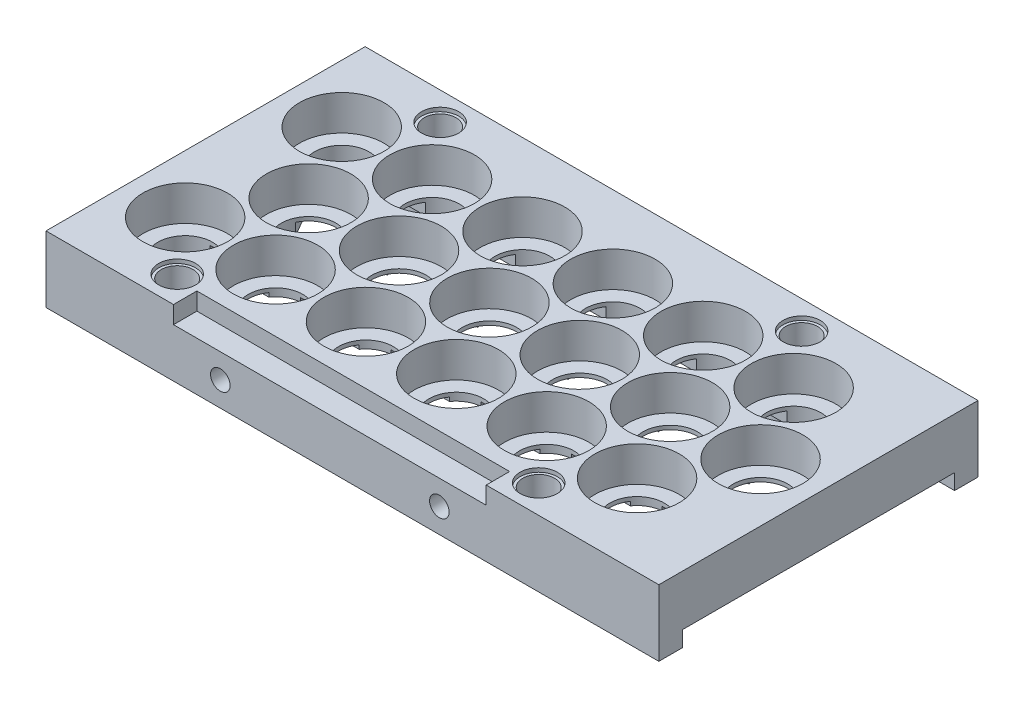
from build123d import *
from build123d.topology import SkipClean

# Parameters (mm, degrees)
SKETCH1_W            = 156.975
SKETCH1_H            = 81.746976195
SKETCH1_R            = 10.825
BOSS_EXTRUDE2_DEPTH  = 11
SKETCH1_3_R          = 10.825
SKETCH1_3_R_2        = 7
BOSS_EXTRUDE3_DEPTH  = 2
CUT_EXTRUDE1_DEPTH   = 1
CUT_EXTRUDE3_REACH   = 157.046
SKETCH9_R            = 4.0767
SKETCH10_R           = 4.7625
CUT_EXTRUDE4_DEPTH   = 1
SKETCH13_R           = 6.5
BOSS_EXTRUDE7_DEPTH  = 6
BOSS_EXTRUDE9_START  = 2
BOSS_EXTRUDE9_DEPTH  = 2
BOSS_EXTRUDE10_DEPTH = 2
SKETCH17_R           = 2.5
CUT_EXTRUDE5_DEPTH   = 4
SKETCH19_W           = 80.1
SKETCH19_H           = 4.475
CUT_EXTRUDE6_DEPTH   = 6
SKETCH20_R           = 2.5
CUT_EXTRUDE7_DEPTH   = 5


with BuildPart() as part:
    # Sketch1 → Boss-Extrude2 (new body)
    with BuildSketch(Plane(origin=(0, 0, 0), x_dir=(1, 0, 0), z_dir=(0, 1, 0))):
        with Locations((63.6625, -20.048488098)):
            Rectangle(SKETCH1_W, SKETCH1_H)
        with Locations((0, -40.096976195)):
            Circle(SKETCH1_R, mode=Mode.SUBTRACT)
        with Locations((23.15, -40.096976195)):
            Circle(SKETCH1_R, mode=Mode.SUBTRACT)
        with Locations((46.3, -40.096976195)):
            Circle(SKETCH1_R, mode=Mode.SUBTRACT)
        with Locations((69.45, -40.096976195)):
            Circle(SKETCH1_R, mode=Mode.SUBTRACT)
        with Locations((92.6, -40.096976195)):
            Circle(SKETCH1_R, mode=Mode.SUBTRACT)
        with Locations((115.75, -40.096976195)):
            Circle(SKETCH1_R, mode=Mode.SUBTRACT)
        with Locations((11.575, -20.048488098)):
            Circle(SKETCH1_R, mode=Mode.SUBTRACT)
        Circle(SKETCH1_R, mode=Mode.SUBTRACT)
        with Locations((23.15, 0)):
            Circle(SKETCH1_R, mode=Mode.SUBTRACT)
        with Locations((34.725, -20.048488098)):
            Circle(SKETCH1_R, mode=Mode.SUBTRACT)
        with Locations((57.875, -20.048488098)):
            Circle(SKETCH1_R, mode=Mode.SUBTRACT)
        with Locations((46.3, 0)):
            Circle(SKETCH1_R, mode=Mode.SUBTRACT)
        with Locations((81.025, -20.048488098)):
            Circle(SKETCH1_R, mode=Mode.SUBTRACT)
        with Locations((69.45, 0)):
            Circle(SKETCH1_R, mode=Mode.SUBTRACT)
        with Locations((92.6, 0)):
            Circle(SKETCH1_R, mode=Mode.SUBTRACT)
        with Locations((104.175, -20.048488098)):
            Circle(SKETCH1_R, mode=Mode.SUBTRACT)
        with Locations((127.325, -20.048488098)):
            Circle(SKETCH1_R, mode=Mode.SUBTRACT)
        with Locations((115.75, 0)):
            Circle(SKETCH1_R, mode=Mode.SUBTRACT)
    extrude(amount=BOSS_EXTRUDE2_DEPTH)

    # Sketch1<3> → Boss-Extrude3 (add)
    # profile 1 of 18: a face of its own
    with BuildSketch(Plane(origin=(0, 0, 0), x_dir=(1, 0, 0), z_dir=(0, 1, 0))):
        Circle(SKETCH1_3_R)
        Circle(SKETCH1_3_R_2, mode=Mode.SUBTRACT)
    # profile 2 of 18: a face of its own
    with BuildSketch(Plane(origin=(0, 0, 0), x_dir=(1, 0, 0), z_dir=(0, 1, 0))):
        with Locations((11.575, -20.048488098)):
            Circle(SKETCH1_3_R)
        with Locations((11.575, -20.048488098)):
            Circle(SKETCH1_3_R_2, mode=Mode.SUBTRACT)
    # profile 3 of 18: a face of its own
    with BuildSketch(Plane(origin=(0, 0, 0), x_dir=(1, 0, 0), z_dir=(0, 1, 0))):
        with Locations((0, -40.096976195)):
            Circle(SKETCH1_3_R)
        with Locations((0, -40.096976195)):
            Circle(SKETCH1_3_R_2, mode=Mode.SUBTRACT)
    # profile 4 of 18: a face of its own
    with BuildSketch(Plane(origin=(0, 0, 0), x_dir=(1, 0, 0), z_dir=(0, 1, 0))):
        with Locations((23.15, 0)):
            Circle(SKETCH1_3_R)
        with Locations((23.15, 0)):
            Circle(SKETCH1_3_R_2, mode=Mode.SUBTRACT)
    # profile 5 of 18: a face of its own
    with BuildSketch(Plane(origin=(0, 0, 0), x_dir=(1, 0, 0), z_dir=(0, 1, 0))):
        with Locations((34.725, -20.048488098)):
            Circle(SKETCH1_3_R)
        with Locations((34.725, -20.048488098)):
            Circle(SKETCH1_3_R_2, mode=Mode.SUBTRACT)
    # profile 6 of 18: a face of its own
    with BuildSketch(Plane(origin=(0, 0, 0), x_dir=(1, 0, 0), z_dir=(0, 1, 0))):
        with Locations((23.15, -40.096976195)):
            Circle(SKETCH1_3_R)
        with Locations((23.15, -40.096976195)):
            Circle(SKETCH1_3_R_2, mode=Mode.SUBTRACT)
    # profile 7 of 18: a face of its own
    with BuildSketch(Plane(origin=(0, 0, 0), x_dir=(1, 0, 0), z_dir=(0, 1, 0))):
        with Locations((46.3, 0)):
            Circle(SKETCH1_3_R)
        with Locations((46.3, 0)):
            Circle(SKETCH1_3_R_2, mode=Mode.SUBTRACT)
    # profile 8 of 18: a face of its own
    with BuildSketch(Plane(origin=(0, 0, 0), x_dir=(1, 0, 0), z_dir=(0, 1, 0))):
        with Locations((57.875, -20.048488098)):
            Circle(SKETCH1_3_R)
        with Locations((57.875, -20.048488098)):
            Circle(SKETCH1_3_R_2, mode=Mode.SUBTRACT)
    # profile 9 of 18: a face of its own
    with BuildSketch(Plane(origin=(0, 0, 0), x_dir=(1, 0, 0), z_dir=(0, 1, 0))):
        with Locations((46.3, -40.096976195)):
            Circle(SKETCH1_3_R)
        with Locations((46.3, -40.096976195)):
            Circle(SKETCH1_3_R_2, mode=Mode.SUBTRACT)
    # profile 10 of 18: a face of its own
    with BuildSketch(Plane(origin=(0, 0, 0), x_dir=(1, 0, 0), z_dir=(0, 1, 0))):
        with Locations((69.45, 0)):
            Circle(SKETCH1_3_R)
        with Locations((69.45, 0)):
            Circle(SKETCH1_3_R_2, mode=Mode.SUBTRACT)
    # profile 11 of 18: a face of its own
    with BuildSketch(Plane(origin=(0, 0, 0), x_dir=(1, 0, 0), z_dir=(0, 1, 0))):
        with Locations((81.025, -20.048488098)):
            Circle(SKETCH1_3_R)
        with Locations((81.025, -20.048488098)):
            Circle(SKETCH1_3_R_2, mode=Mode.SUBTRACT)
    # profile 12 of 18: a face of its own
    with BuildSketch(Plane(origin=(0, 0, 0), x_dir=(1, 0, 0), z_dir=(0, 1, 0))):
        with Locations((69.45, -40.096976195)):
            Circle(SKETCH1_3_R)
        with Locations((69.45, -40.096976195)):
            Circle(SKETCH1_3_R_2, mode=Mode.SUBTRACT)
    # profile 13 of 18: a face of its own
    with BuildSketch(Plane(origin=(0, 0, 0), x_dir=(1, 0, 0), z_dir=(0, 1, 0))):
        with Locations((92.6, 0)):
            Circle(SKETCH1_3_R)
        with Locations((92.6, 0)):
            Circle(SKETCH1_3_R_2, mode=Mode.SUBTRACT)
    # profile 14 of 18: a face of its own
    with BuildSketch(Plane(origin=(0, 0, 0), x_dir=(1, 0, 0), z_dir=(0, 1, 0))):
        with Locations((104.175, -20.048488098)):
            Circle(SKETCH1_3_R)
        with Locations((104.175, -20.048488098)):
            Circle(SKETCH1_3_R_2, mode=Mode.SUBTRACT)
    # profile 15 of 18: a face of its own
    with BuildSketch(Plane(origin=(0, 0, 0), x_dir=(1, 0, 0), z_dir=(0, 1, 0))):
        with Locations((92.6, -40.096976195)):
            Circle(SKETCH1_3_R)
        with Locations((92.6, -40.096976195)):
            Circle(SKETCH1_3_R_2, mode=Mode.SUBTRACT)
    # profile 16 of 18: a face of its own
    with BuildSketch(Plane(origin=(0, 0, 0), x_dir=(1, 0, 0), z_dir=(0, 1, 0))):
        with Locations((115.75, 0)):
            Circle(SKETCH1_3_R)
        with Locations((115.75, 0)):
            Circle(SKETCH1_3_R_2, mode=Mode.SUBTRACT)
    # profile 17 of 18: a face of its own
    with BuildSketch(Plane(origin=(0, 0, 0), x_dir=(1, 0, 0), z_dir=(0, 1, 0))):
        with Locations((127.325, -20.048488098)):
            Circle(SKETCH1_3_R)
        with Locations((127.325, -20.048488098)):
            Circle(SKETCH1_3_R_2, mode=Mode.SUBTRACT)
    # profile 18 of 18: a face of its own
    with BuildSketch(Plane(origin=(0, 0, 0), x_dir=(1, 0, 0), z_dir=(0, 1, 0))):
        with Locations((115.75, -40.096976195)):
            Circle(SKETCH1_3_R)
        with Locations((115.75, -40.096976195)):
            Circle(SKETCH1_3_R_2, mode=Mode.SUBTRACT)
    extrude(amount=BOSS_EXTRUDE3_DEPTH)

    # Sketch2 → Cut-Extrude1 (cut)
    with BuildSketch(Plane.XZ):
        with BuildLine():
            Line((-0.591820292, 33.12203901), (5.238617062, 23.023425283))
            ThreePointArc((5.238617062, 23.023425283), (8.075, 26.110665924), (12.166820292, 27.023425283))
            Line((12.166820292, 27.023425283), (6.92820323, 36.096976195))
            Line((6.92820323, 36.096976195), (17.405437353, 36.096976195))
            ThreePointArc((17.405437353, 36.096976195), (16.15, 40.096976195), (17.405437353, 44.096976195))
            Line((17.405437353, 44.096976195), (5.744562647, 44.096976195))
            ThreePointArc((5.744562647, 44.096976195), (6.062177826, 36.596976195), (-0.591820292, 33.12203901))
        make_face()
        with BuildLine():
            Line((27.79679677, 24.048488098), (17.319562647, 24.048488098))
            ThreePointArc((17.319562647, 24.048488098), (18.575, 20.048488098), (17.319562647, 16.048488098))
            Line((17.319562647, 16.048488098), (27.79679677, 16.048488098))
            Line((27.79679677, 16.048488098), (22.558179708, 6.974937186))
            ThreePointArc((22.558179708, 6.974937186), (26.124937186, 6.336382938), (28.894562647, 4))
            Line((28.894562647, 4), (6.92820323, 4))
            Line((6.92820323, 4), (12.166820292, 13.073550912))
            ThreePointArc((12.166820292, 13.073550912), (8.075, 13.986310271), (5.238617062, 17.073550912))
            Line((5.238617062, 17.073550912), (-0.591820292, 6.974937186))
            ThreePointArc((-0.591820292, 6.974937186), (2.974937186, 6.336382938), (5.744562647, 4))
            Line((5.744562647, 4), (0, 4))
            ThreePointArc((0, 4), (-4, 0), (0, -4))
            Line((0, -4), (115.75, -4))
            ThreePointArc((115.75, -4), (119.75, 0), (115.75, 4))
            Line((115.75, 4), (99.52820323, 4))
            Line((99.52820323, 4), (104.766820292, 13.073550912))
            ThreePointArc((104.766820292, 13.073550912), (97.175, 20.048488098), (104.766820292, 27.023425283))
            Line((104.766820292, 27.023425283), (99.52820323, 36.096976195))
            Line((99.52820323, 36.096976195), (110.005437353, 36.096976195))
            ThreePointArc((110.005437353, 36.096976195), (108.75, 40.096976195), (110.005437353, 44.096976195))
            Line((110.005437353, 44.096976195), (98.344562647, 44.096976195))
            ThreePointArc((98.344562647, 44.096976195), (98.662177826, 36.596976195), (92.008179708, 33.12203901))
            Line((92.008179708, 33.12203901), (97.24679677, 24.048488098))
            Line((97.24679677, 24.048488098), (86.769562647, 24.048488098))
            ThreePointArc((86.769562647, 24.048488098), (88.025, 20.048488098), (86.769562647, 16.048488098))
            Line((86.769562647, 16.048488098), (97.24679677, 16.048488098))
            Line((97.24679677, 16.048488098), (92.008179708, 6.974937186))
            ThreePointArc((92.008179708, 6.974937186), (95.574937186, 6.336382938), (98.344562647, 4))
            Line((98.344562647, 4), (76.37820323, 4))
            Line((76.37820323, 4), (81.616820292, 13.073550912))
            ThreePointArc((81.616820292, 13.073550912), (74.025, 20.048488098), (81.616820292, 27.023425283))
            Line((81.616820292, 27.023425283), (76.37820323, 36.096976195))
            Line((76.37820323, 36.096976195), (86.855437353, 36.096976195))
            ThreePointArc((86.855437353, 36.096976195), (85.6, 40.096976195), (86.855437353, 44.096976195))
            Line((86.855437353, 44.096976195), (75.194562647, 44.096976195))
            ThreePointArc((75.194562647, 44.096976195), (75.512177826, 36.596976195), (68.858179708, 33.12203901))
            Line((68.858179708, 33.12203901), (74.09679677, 24.048488098))
            Line((74.09679677, 24.048488098), (63.619562647, 24.048488098))
            ThreePointArc((63.619562647, 24.048488098), (64.875, 20.048488098), (63.619562647, 16.048488098))
            Line((63.619562647, 16.048488098), (74.09679677, 16.048488098))
            Line((74.09679677, 16.048488098), (68.858179708, 6.974937186))
            ThreePointArc((68.858179708, 6.974937186), (72.424937186, 6.336382938), (75.194562647, 4))
            Line((75.194562647, 4), (53.22820323, 4))
            Line((53.22820323, 4), (58.466820292, 13.073550912))
            ThreePointArc((58.466820292, 13.073550912), (50.875, 20.048488098), (58.466820292, 27.023425283))
            Line((58.466820292, 27.023425283), (53.22820323, 36.096976195))
            Line((53.22820323, 36.096976195), (63.705437353, 36.096976195))
            ThreePointArc((63.705437353, 36.096976195), (62.45, 40.096976195), (63.705437353, 44.096976195))
            Line((63.705437353, 44.096976195), (52.044562647, 44.096976195))
            ThreePointArc((52.044562647, 44.096976195), (52.362177826, 36.596976195), (45.708179708, 33.12203901))
            Line((45.708179708, 33.12203901), (50.94679677, 24.048488098))
            Line((50.94679677, 24.048488098), (40.469562647, 24.048488098))
            ThreePointArc((40.469562647, 24.048488098), (41.725, 20.048488098), (40.469562647, 16.048488098))
            Line((40.469562647, 16.048488098), (50.94679677, 16.048488098))
            Line((50.94679677, 16.048488098), (45.708179708, 6.974937186))
            ThreePointArc((45.708179708, 6.974937186), (49.274937186, 6.336382938), (52.044562647, 4))
            Line((52.044562647, 4), (30.07820323, 4))
            Line((30.07820323, 4), (35.316820292, 13.073550912))
            ThreePointArc((35.316820292, 13.073550912), (27.725, 20.048488098), (35.316820292, 27.023425283))
            Line((35.316820292, 27.023425283), (30.07820323, 36.096976195))
            Line((30.07820323, 36.096976195), (40.555437353, 36.096976195))
            ThreePointArc((40.555437353, 36.096976195), (39.3, 40.096976195), (40.555437353, 44.096976195))
            Line((40.555437353, 44.096976195), (28.894562647, 44.096976195))
            ThreePointArc((28.894562647, 44.096976195), (29.212177826, 36.596976195), (22.558179708, 33.12203901))
            Line((22.558179708, 33.12203901), (27.79679677, 24.048488098))
        make_face()
        with BuildLine():
            Line((127.916820292, 27.023425283), (122.086382938, 37.12203901))
            ThreePointArc((122.086382938, 37.12203901), (119.25, 34.034798369), (115.158179708, 33.12203901))
            Line((115.158179708, 33.12203901), (120.39679677, 24.048488098))
            Line((120.39679677, 24.048488098), (109.919562647, 24.048488098))
            ThreePointArc((109.919562647, 24.048488098), (111.175, 20.048488098), (109.919562647, 16.048488098))
            Line((109.919562647, 16.048488098), (120.39679677, 16.048488098))
            Line((120.39679677, 16.048488098), (115.158179708, 6.974937186))
            ThreePointArc((115.158179708, 6.974937186), (119.25, 6.062177826), (122.086382938, 2.974937186))
            Line((122.086382938, 2.974937186), (127.916820292, 13.073550912))
            ThreePointArc((127.916820292, 13.073550912), (120.325, 20.048488098), (127.916820292, 27.023425283))
        make_face()
    extrude(amount=-CUT_EXTRUDE1_DEPTH, mode=Mode.SUBTRACT)

    # Sketch9 → Cut-Extrude3 (cut, up to next)
    with BuildSketch(Plane(origin=(0, 11, 0), x_dir=(1, 0, 0), z_dir=(0, 1, 0)), mode=Mode.PRIVATE) as cut_extrude3_sk1:
        with Locations((11.575, 13.625)):
            Circle(SKETCH9_R)
    cut_extrude3_tool1 = extrude(cut_extrude3_sk1.sketch, amount=-CUT_EXTRUDE3_REACH, mode=Mode.PRIVATE) & part.part
    # Sketch9 → Cut-Extrude3 (cut, up to next)
    with BuildSketch(Plane(origin=(0, 11, 0), x_dir=(1, 0, 0), z_dir=(0, 1, 0)), mode=Mode.PRIVATE) as cut_extrude3_sk2:
        with Locations((11.575, -53.721976195)):
            Circle(SKETCH9_R)
    cut_extrude3_tool2 = extrude(cut_extrude3_sk2.sketch, amount=-CUT_EXTRUDE3_REACH, mode=Mode.PRIVATE) & part.part
    # Sketch9 → Cut-Extrude3 (cut, up to next)
    with BuildSketch(Plane(origin=(0, 11, 0), x_dir=(1, 0, 0), z_dir=(0, 1, 0)), mode=Mode.PRIVATE) as cut_extrude3_sk3:
        with Locations((104.175, -53.721976195)):
            Circle(SKETCH9_R)
    cut_extrude3_tool3 = extrude(cut_extrude3_sk3.sketch, amount=-CUT_EXTRUDE3_REACH, mode=Mode.PRIVATE) & part.part
    # Sketch9 → Cut-Extrude3 (cut, up to next)
    with BuildSketch(Plane(origin=(0, 11, 0), x_dir=(1, 0, 0), z_dir=(0, 1, 0)), mode=Mode.PRIVATE) as cut_extrude3_sk4:
        with Locations((104.175, 13.625)):
            Circle(SKETCH9_R)
    cut_extrude3_tool4 = extrude(cut_extrude3_sk4.sketch, amount=-CUT_EXTRUDE3_REACH, mode=Mode.PRIVATE) & part.part
    add(cut_extrude3_tool1.solids().sort_by_distance((11.575, 11, -13.625))[0], mode=Mode.SUBTRACT)
    add(cut_extrude3_tool2.solids().sort_by_distance((11.575, 11, 53.721976))[0], mode=Mode.SUBTRACT)
    add(cut_extrude3_tool3.solids().sort_by_distance((104.175, 11, 53.721976))[0], mode=Mode.SUBTRACT)
    add(cut_extrude3_tool4.solids().sort_by_distance((104.175, 11, -13.625))[0], mode=Mode.SUBTRACT)

    # Sketch10 → Cut-Extrude4 (cut)
    with BuildSketch(Plane(origin=(0, 11, 0), x_dir=(1, 0, 0), z_dir=(0, 1, 0))):
        with Locations((11.575, 13.625)):
            Circle(SKETCH10_R)
        with Locations((104.175, 13.625)):
            Circle(SKETCH10_R)
        with Locations((104.175, -53.721976195)):
            Circle(SKETCH10_R)
        with Locations((11.575, -53.721976195)):
            Circle(SKETCH10_R)
    extrude(amount=-CUT_EXTRUDE4_DEPTH, mode=Mode.SUBTRACT)

    # Sketch13 → Boss-Extrude7 (add)
    # profile 1 of 2: a face of its own
    with BuildSketch(Plane.XZ):
        with BuildLine():
            ThreePointArc((3.665512027, 54.921976195), (11.575, 45.721976195), (19.484487973, 54.921976195))
            Line((19.484487973, 54.921976195), (96.265512027, 54.921976195))
            ThreePointArc((96.265512027, 54.921976195), (104.175, 45.721976195), (112.084487973, 54.921976195))
            Line((112.084487973, 54.921976195), (142.15, 54.921976195))
            Line((142.15, 54.921976195), (142.15, 60.921976195))
            Line((142.15, 60.921976195), (-14.825, 60.921976195))
            Line((-14.825, 60.921976195), (-14.825, 54.921976195))
            Line((-14.825, 54.921976195), (3.665512027, 54.921976195))
        make_face()
        with Locations((11.575, 53.721976195)):
            Circle(SKETCH13_R, mode=Mode.SUBTRACT)
        with Locations((104.175, 53.721976195)):
            Circle(SKETCH13_R, mode=Mode.SUBTRACT)
    # profile 2 of 2: a face of its own
    with BuildSketch(Plane.XZ):
        with BuildLine():
            Line((-14.825, -14.825), (-14.825, -20.825))
            Line((-14.825, -20.825), (142.15, -20.825))
            Line((142.15, -20.825), (142.15, -14.825))
            Line((142.15, -14.825), (112.084487973, -14.825))
            ThreePointArc((112.084487973, -14.825), (104.175, -5.625), (96.265512027, -14.825))
            Line((96.265512027, -14.825), (19.484487973, -14.825))
            ThreePointArc((19.484487973, -14.825), (11.575, -5.625), (3.665512027, -14.825))
            Line((3.665512027, -14.825), (-14.825, -14.825))
        make_face()
        with Locations((11.575, -13.625)):
            Circle(SKETCH13_R, mode=Mode.SUBTRACT)
        with Locations((104.175, -13.625)):
            Circle(SKETCH13_R, mode=Mode.SUBTRACT)
    extrude(amount=BOSS_EXTRUDE7_DEPTH)

    # Sketch14 → Boss-Extrude9 (add)
    with SkipClean():  # the faces are left unmerged after this step: merging them gives an invalid solid
        with BuildSketch(Plane.XZ.offset(BOSS_EXTRUDE9_START)):
            with BuildLine():
                Line((142.15, 54.921976195), (142.15, -14.825))
                Line((142.15, -14.825), (112.084487973, -14.825))
                ThreePointArc((112.084487973, -14.825), (104.175, -5.625), (96.265512027, -14.825))
                Line((96.265512027, -14.825), (19.484487973, -14.825))
                ThreePointArc((19.484487973, -14.825), (11.575, -5.625), (3.665512027, -14.825))
                Line((3.665512027, -14.825), (-14.825, -14.825))
                Line((-14.825, -14.825), (-14.825, 54.921976195))
                Line((-14.825, 54.921976195), (3.665512027, 54.921976195))
                ThreePointArc((3.665512027, 54.921976195), (11.575, 45.721976195), (19.484487973, 54.921976195))
                Line((19.484487973, 54.921976195), (96.265512027, 54.921976195))
                ThreePointArc((96.265512027, 54.921976195), (104.175, 45.721976195), (112.084487973, 54.921976195))
                Line((112.084487973, 54.921976195), (142.15, 54.921976195))
            make_face()
            with BuildLine():
                Line((5.238617062, 17.073550912), (-0.591820292, 6.974937186))
                ThreePointArc((-0.591820292, 6.974937186), (-6.062177826, -3.5), (5.744562647, -4))
                Line((5.744562647, -4), (17.405437353, -4))
                ThreePointArc((17.405437353, -4), (23.15, -7), (28.894562647, -4))
                Line((28.894562647, -4), (40.555437353, -4))
                ThreePointArc((40.555437353, -4), (46.3, -7), (52.044562647, -4))
                Line((52.044562647, -4), (63.705437353, -4))
                ThreePointArc((63.705437353, -4), (69.45, -7), (75.194562647, -4))
                Line((75.194562647, -4), (86.855437353, -4))
                ThreePointArc((86.855437353, -4), (92.6, -7), (98.344562647, -4))
                Line((98.344562647, -4), (110.005437353, -4))
                ThreePointArc((110.005437353, -4), (119.25, -6.062177826), (122.086382938, 2.974937186))
                Line((122.086382938, 2.974937186), (127.916820292, 13.073550912))
                ThreePointArc((127.916820292, 13.073550912), (134.325, 20.048488098), (127.916820292, 27.023425283))
                Line((127.916820292, 27.023425283), (122.086382938, 37.12203901))
                ThreePointArc((122.086382938, 37.12203901), (119.25, 46.159154022), (110.005437353, 44.096976195))
                Line((110.005437353, 44.096976195), (98.344562647, 44.096976195))
                ThreePointArc((98.344562647, 44.096976195), (92.6, 47.096976195), (86.855437353, 44.096976195))
                Line((86.855437353, 44.096976195), (75.194562647, 44.096976195))
                ThreePointArc((75.194562647, 44.096976195), (69.45, 47.096976195), (63.705437353, 44.096976195))
                Line((63.705437353, 44.096976195), (52.044562647, 44.096976195))
                ThreePointArc((52.044562647, 44.096976195), (46.3, 47.096976195), (40.555437353, 44.096976195))
                Line((40.555437353, 44.096976195), (28.894562647, 44.096976195))
                ThreePointArc((28.894562647, 44.096976195), (23.15, 47.096976195), (17.405437353, 44.096976195))
                Line((17.405437353, 44.096976195), (5.744562647, 44.096976195))
                ThreePointArc((5.744562647, 44.096976195), (-6.062177826, 43.596976195), (-0.591820292, 33.12203901))
                Line((-0.591820292, 33.12203901), (5.238617062, 23.023425283))
                ThreePointArc((5.238617062, 23.023425283), (4.575, 20.048488098), (5.238617062, 17.073550912))
            make_face(mode=Mode.SUBTRACT)
        extrude(amount=-BOSS_EXTRUDE9_DEPTH)

    # Sketch16 → Boss-Extrude10 (add)
    with SkipClean():  # the faces are left unmerged after this step: merging them gives an invalid solid
        with BuildSketch(Plane.XZ):
            with BuildLine():
                Line((15.536128823, 32.859238845), (20.688871177, 29.884301659))
                ThreePointArc((20.688871177, 29.884301659), (21.237909283, 27.835263554), (19.188871177, 27.286225448))
                Line((19.188871177, 27.286225448), (14.036128823, 30.261162634))
                ThreePointArc((14.036128823, 30.261162634), (13.487090717, 32.310200739), (15.536128823, 32.859238845))
            make_face()
            with BuildLine():
                Line((38.686128823, 32.859238845), (43.838871177, 29.884301659))
                ThreePointArc((43.838871177, 29.884301659), (44.387909283, 27.835263554), (42.338871177, 27.286225448))
                Line((42.338871177, 27.286225448), (37.186128823, 30.261162634))
                ThreePointArc((37.186128823, 30.261162634), (36.637090717, 32.310200739), (38.686128823, 32.859238845))
            make_face()
            with BuildLine():
                Line((61.836128823, 32.859238845), (66.988871177, 29.884301659))
                ThreePointArc((66.988871177, 29.884301659), (67.537909283, 27.835263554), (65.488871177, 27.286225448))
                Line((65.488871177, 27.286225448), (60.336128823, 30.261162634))
                ThreePointArc((60.336128823, 30.261162634), (59.787090717, 32.310200739), (61.836128823, 32.859238845))
            make_face()
            with BuildLine():
                Line((84.986128823, 32.859238845), (90.138871177, 29.884301659))
                ThreePointArc((90.138871177, 29.884301659), (90.687909283, 27.835263554), (88.638871177, 27.286225448))
                Line((88.638871177, 27.286225448), (83.486128823, 30.261162634))
                ThreePointArc((83.486128823, 30.261162634), (82.937090717, 32.310200739), (84.986128823, 32.859238845))
            make_face()
            with BuildLine():
                Line((108.136128823, 32.859238845), (113.288871177, 29.884301659))
                ThreePointArc((113.288871177, 29.884301659), (113.837909283, 27.835263554), (111.788871177, 27.286225448))
                Line((111.788871177, 27.286225448), (106.636128823, 30.261162634))
                ThreePointArc((106.636128823, 30.261162634), (106.087090717, 32.310200739), (108.136128823, 32.859238845))
            make_face()
            with BuildLine():
                Line((15.536128823, 7.23773735), (20.688871177, 10.212674536))
                ThreePointArc((20.688871177, 10.212674536), (21.237909283, 12.261712642), (19.188871177, 12.810750747))
                Line((19.188871177, 12.810750747), (14.036128823, 9.835813562))
                ThreePointArc((14.036128823, 9.835813562), (13.487090717, 7.786775456), (15.536128823, 7.23773735))
            make_face()
            with BuildLine():
                Line((38.686128823, 7.23773735), (43.838871177, 10.212674536))
                ThreePointArc((43.838871177, 10.212674536), (44.387909283, 12.261712642), (42.338871177, 12.810750747))
                Line((42.338871177, 12.810750747), (37.186128823, 9.835813562))
                ThreePointArc((37.186128823, 9.835813562), (36.637090717, 7.786775456), (38.686128823, 7.23773735))
            make_face()
            with BuildLine():
                Line((61.836128823, 7.23773735), (66.988871177, 10.212674536))
                ThreePointArc((66.988871177, 10.212674536), (67.537909283, 12.261712642), (65.488871177, 12.810750747))
                Line((65.488871177, 12.810750747), (60.336128823, 9.835813562))
                ThreePointArc((60.336128823, 9.835813562), (59.787090717, 7.786775456), (61.836128823, 7.23773735))
            make_face()
            with BuildLine():
                Line((84.986128823, 7.23773735), (90.138871177, 10.212674536))
                ThreePointArc((90.138871177, 10.212674536), (90.687909283, 12.261712642), (88.638871177, 12.810750747))
                Line((88.638871177, 12.810750747), (83.486128823, 9.835813562))
                ThreePointArc((83.486128823, 9.835813562), (82.937090717, 7.786775456), (84.986128823, 7.23773735))
            make_face()
            with BuildLine():
                Line((108.136128823, 7.23773735), (113.288871177, 10.212674536))
                ThreePointArc((113.288871177, 10.212674536), (113.837909283, 12.261712642), (111.788871177, 12.810750747))
                Line((111.788871177, 12.810750747), (106.636128823, 9.835813562))
                ThreePointArc((106.636128823, 9.835813562), (106.087090717, 7.786775456), (108.136128823, 7.23773735))
            make_face()
        extrude(amount=BOSS_EXTRUDE10_DEPTH)

    # Sketch17 → Cut-Extrude5 (cut)
    with BuildSketch(Plane(origin=(0, -2, 0), x_dir=(-1, 0, 0), z_dir=(0, -1, 0))):
        with Locations((10.825, -49.509476195)):
            Circle(SKETCH17_R)
        with Locations((-57.875, -49.509476195)):
            Circle(SKETCH17_R)
        with Locations((-132.15, -49.509476195)):
            Circle(SKETCH17_R)
        with Locations((-132.15, 9.4125)):
            Circle(SKETCH17_R)
        with Locations((-57.875, 9.4125)):
            Circle(SKETCH17_R)
        with Locations((10.825, 9.4125)):
            Circle(SKETCH17_R)
    extrude(amount=-CUT_EXTRUDE5_DEPTH, mode=Mode.SUBTRACT)

    # Sketch19 → Cut-Extrude6 (cut)
    with BuildSketch(Plane.XY.offset(60.921976195)):
        with Locations((57.875, 8.7625)):
            Rectangle(SKETCH19_W, SKETCH19_H)
    extrude(amount=-CUT_EXTRUDE6_DEPTH, mode=Mode.SUBTRACT)

    # Sketch20 → Cut-Extrude7 (cut)
    with BuildSketch(Plane.XY.offset(60.921976195)):
        with Locations((29.825, 0.2625)):
            Circle(SKETCH20_R)
        with Locations((85.925, 0.2625)):
            Circle(SKETCH20_R)
    extrude(amount=-CUT_EXTRUDE7_DEPTH, mode=Mode.SUBTRACT)


solid = part.part
